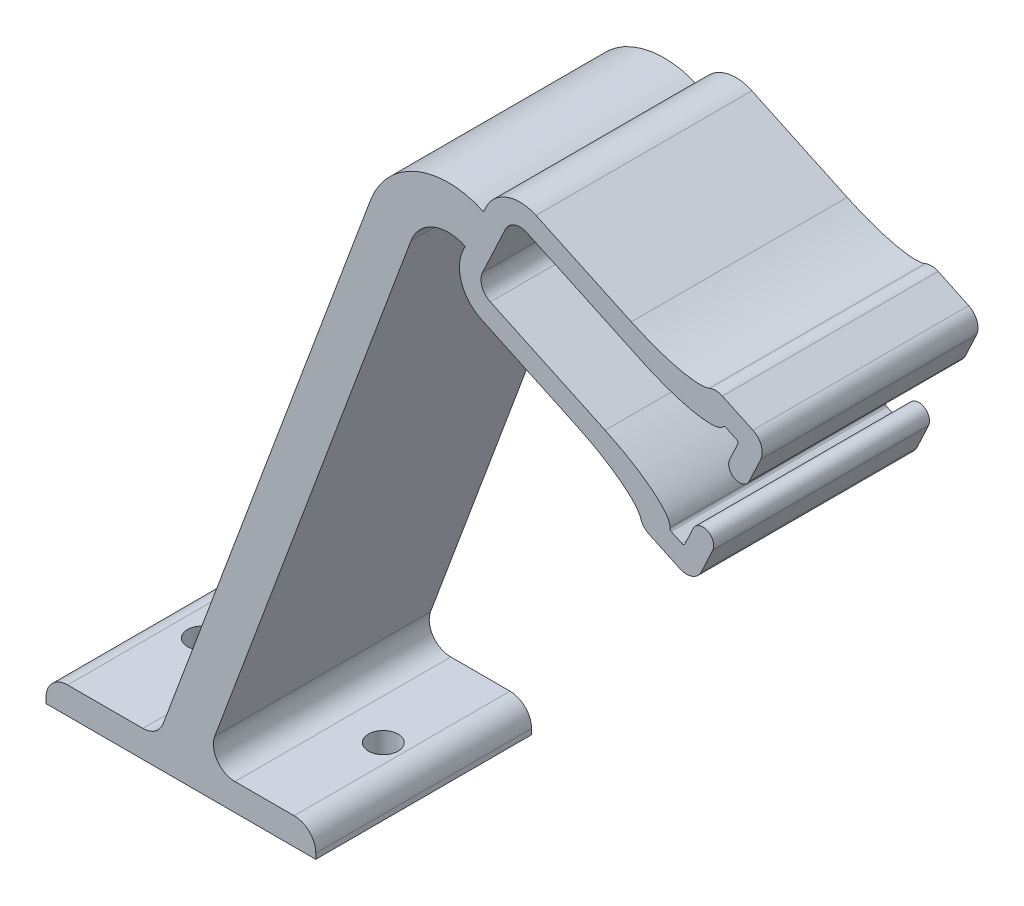
from build123d import *

# Parameters (mm, degrees)
BOSS_EXTRUDE1_DEPTH = 40
FILLET1_SIZE        = 15
FILLET1_SIZE_2      = 4
FILLET2_SIZE        = 15
FILLET2_SIZE_2      = 4
FILLET3_SIZE        = 15
FILLET3_SIZE_2      = 4
FILLET4_SIZE        = 15
FILLET4_SIZE_2      = 4
FILLET5_R           = 3
FILLET6_R           = 0.45
FILLET8_R           = 7
FILLET9_R           = 3
FILLET10_R          = 4
CUT_EXTRUDE1_DEPTH  = 147.245106811
FILLET11_R          = 4


with BuildPart() as part:
    # Sketch1 → Boss-Extrude1 (new body)
    with BuildSketch(Plane.XY):
        with BuildLine():
            ThreePointArc((6.77692336, 14.493905953), (-5.565334282, 14.795328723), (-14.153654854, 5.926116291))
            Line((-14.153654854, 5.926116291), (-53.584656115, -100))
            Line((-53.584656115, -100), (-74.316504114, -100))
            Line((-74.316504114, -100), (-74.316504114, -105))
            Line((-74.316504114, -105), (-24.316504114, -105))
            Line((-24.316504114, -105), (-24.316504114, -100))
            Line((-24.316504114, -100), (-45.048352113, -100))
            Line((-45.048352113, -100), (-6.656264884, 3.135212559))
            ThreePointArc((-6.656264884, 3.135212559), (-2.534671543, 7.39160781), (3.38846168, 7.246952976))
            Line((3.38846168, 7.246952976), (0, 0))
            Line((0, 0), (37.593568565, -17.577644966))
            Line((37.593568565, -17.577644966), (35.899337725, -21.201121454))
            Line((35.899337725, -21.201121454), (45.863898068, -25.860256264))
            Line((45.863898068, -25.860256264), (49.252359748, -18.613303288))
            ThreePointArc((49.252359748, -18.613303288), (48.287736924, -15.954449623), (45.62888326, -16.919072448))
            Line((45.62888326, -16.919072448), (43.93465242, -20.542548936))
            Line((43.93465242, -20.542548936), (41.217045053, -19.271875806))
            Line((41.217045053, -19.271875806), (42.911275893, -15.648399317))
            Line((42.911275893, -15.648399317), (5.317707328, 1.929245648))
            Line((5.317707328, 1.929245648), (12.094630689, 16.423151601))
            Line((12.094630689, 16.423151601), (49.688199254, -1.154493365))
            Line((49.688199254, -1.154493365), (51.382430094, 2.468983124))
            Line((51.382430094, 2.468983124), (54.10003746, 1.198309994))
            Line((54.10003746, 1.198309994), (52.40580662, -2.425166495))
            ThreePointArc((52.40580662, -2.425166495), (53.370429444, -5.084020159), (56.029283108, -4.119397335))
            Line((56.029283108, -4.119397335), (59.417744788, 3.127555642))
            Line((59.417744788, 3.127555642), (49.453184446, 7.786690452))
            Line((49.453184446, 7.786690452), (47.758953606, 4.163213964))
            Line((47.758953606, 4.163213964), (10.16538504, 21.740858929))
            Line((10.16538504, 21.740858929), (6.77692336, 14.493905953))
        make_face()
    extrude(amount=BOSS_EXTRUDE1_DEPTH)

    # Fillet1
    # an asymmetric fillet: 15, 4 mm, written as the material it takes off along each edge
    with BuildSketch(Plane(origin=(49.688199254, -1.154493365, -37.5), x_dir=(-0.9058691220518403, 0.42355771001485515, 0), z_dir=(0, 0, 1))) as fillet1_piece_1:
        with BuildLine():
            Bezier((FILLET1_SIZE, 0), (0, 0), (0, -FILLET1_SIZE_2), weights=[1, 0.707106781, 1])
            Line((0, -FILLET1_SIZE_2), (0, 0))
            Line((0, 0), (FILLET1_SIZE, 0))
        make_face()
    extrude(amount=115, mode=Mode.SUBTRACT)

    # Fillet2
    # an asymmetric fillet: 15, 4 mm, written as the material it adds along each edge
    with BuildSketch(Plane(origin=(47.758953606, 4.163213964, 0), x_dir=(-0.9058691220518406, 0.42355771001485454, 0), z_dir=(0, 0, 1))) as fillet2_piece_1:
        with BuildLine():
            Bezier((FILLET2_SIZE, 0), (0, 0), (0, -FILLET2_SIZE_2), weights=[1, 0.707106781, 1])
            Line((0, -FILLET2_SIZE_2), (0, 0))
            Line((0, 0), (FILLET2_SIZE, 0))
        make_face()
    extrude(amount=40)

    # Fillet3
    # an asymmetric fillet: 15, 4 mm, written as the material it takes off along each edge
    with BuildSketch(Plane(origin=(42.911275893, -15.648399317, -37.5), x_dir=(-0.9058691220518403, 0.4235577100148549, 0), z_dir=(0, 0, 1))) as fillet3_piece_1:
        with BuildLine():
            Bezier((FILLET3_SIZE, 0), (0, 0), (0, FILLET3_SIZE_2), weights=[1, 0.707106781, 1])
            Line((0, FILLET3_SIZE_2), (0, 0))
            Line((0, 0), (FILLET3_SIZE, 0))
        make_face()
    extrude(amount=115, mode=Mode.SUBTRACT)

    # Fillet4
    # an asymmetric fillet: 15, 4 mm, written as the material it adds along each edge
    with BuildSketch(Plane(origin=(37.593568565, -17.577644966, 0), x_dir=(-0.9058691220518404, 0.42355771001485476, 0), z_dir=(0, 0, 1))) as fillet4_piece_1:
        with BuildLine():
            Bezier((FILLET4_SIZE, 0), (0, 0), (0, FILLET4_SIZE_2), weights=[1, 0.707106781, 1])
            Line((0, FILLET4_SIZE_2), (0, 0))
            Line((0, 0), (FILLET4_SIZE, 0))
        make_face()
    extrude(amount=40)

    # Fillet5
    fillet5_edges = [part.edges().sort_by_distance(p)[0] for p in [
        (45.863898068, -25.860256264, 20),
        (59.417744788, 3.127555642, 20),
        (35.899337725, -21.201121454, 20),
        (49.453184446, 7.786690452, 20),
    ]]
    fillet(fillet5_edges, radius=FILLET5_R)

    # Fillet6
    fillet6_edges = [part.edges().sort_by_distance(p)[0] for p in [
        (41.217045053, -19.271875806, 20),
        (43.93465242, -20.542548936, 20),
        (51.382430094, 2.468983124, 20),
        (54.10003746, 1.198309994, 20),
    ]]
    fillet(fillet6_edges, radius=FILLET6_R)

    # Fillet8
    fillet8_edges = [part.edges().sort_by_distance(p)[0] for p in [
        (0, 0, 20),
        (10.16538504, 21.740858929, 20),
    ]]
    fillet(fillet8_edges, radius=FILLET8_R)

    # Fillet9
    fillet9_edges = [part.edges().sort_by_distance(p)[0] for p in [
        (5.317707328, 1.929245648, 20),
        (12.094630689, 16.423151601, 20),
    ]]
    fillet(fillet9_edges, radius=FILLET9_R)

    # Fillet10
    fillet10_edges = [part.edges().sort_by_distance(p)[0] for p in [
        (-45.048352113, -100, 20),
        (-53.584656115, -100, 20),
    ]]
    fillet(fillet10_edges, radius=FILLET10_R)

    # Sketch2 → Cut-Extrude1 (cut, through all)
    with BuildSketch(Plane(origin=(0, -100, 0), x_dir=(1, 0, 0), z_dir=(0, 1, 0))):
        with BuildLine():
            ThreePointArc((-68.09015603, -20), (-65.34015603, -22.75), (-62.59015603, -20))
            Line((-62.59015603, -20), (-68.09015603, -20))
        make_face()
        with BuildLine():
            Line((-68.09015603, -20), (-62.59015603, -20))
            ThreePointArc((-62.59015603, -20), (-65.34015603, -17.25), (-68.09015603, -20))
        make_face()
        with BuildLine():
            ThreePointArc((-34.553852028, -20), (-31.803852028, -22.75), (-29.053852028, -20))
            Line((-29.053852028, -20), (-34.553852028, -20))
        make_face()
        with BuildLine():
            Line((-34.553852028, -20), (-29.053852028, -20))
            ThreePointArc((-29.053852028, -20), (-31.803852028, -17.25), (-34.553852028, -20))
        make_face()
    extrude(amount=-CUT_EXTRUDE1_DEPTH, mode=Mode.SUBTRACT)

    # Fillet11
    fillet11_edges = [part.edges().sort_by_distance(p)[0] for p in [
        (-24.316504114, -100, 20),
        (-74.316504114, -100, 20),
    ]]
    fillet(fillet11_edges, radius=FILLET11_R)


solid = part.part
